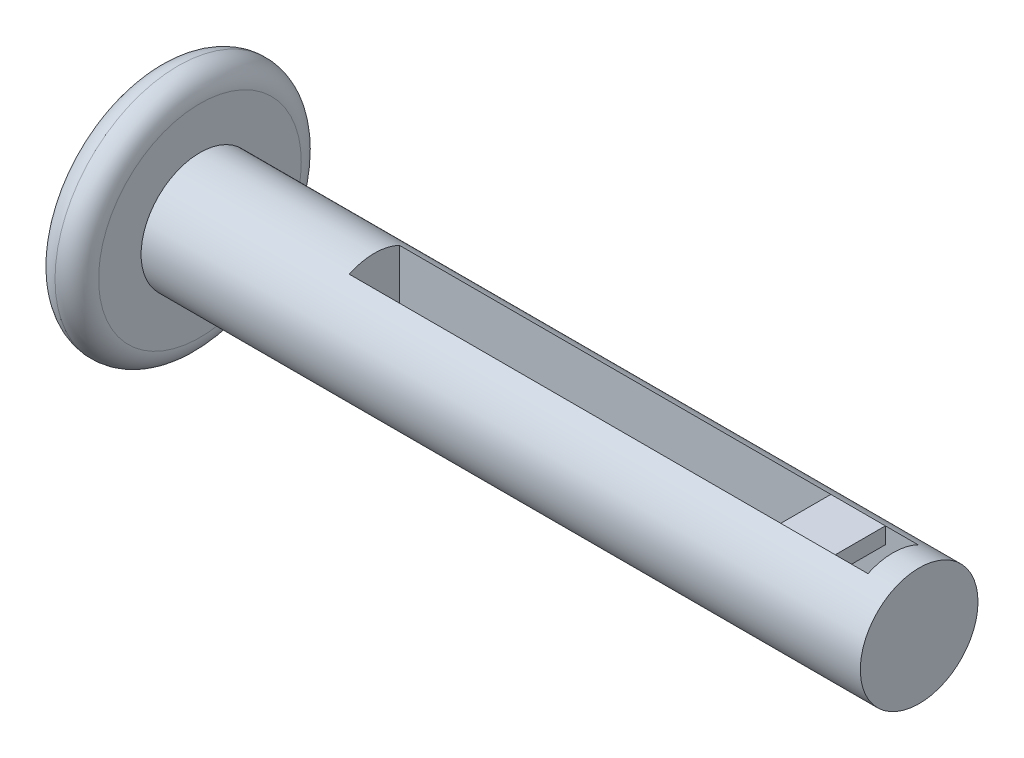
from build123d import *

# Parameters (mm, degrees)
SKETCH1_R               = 143.51
BOSS_EXTRUDE1_DEPTH     = 50.8
SKETCH2_R               = 68.58
BOSS_EXTRUDE2_DEPTH     = 838.2
CUT_EXTRUDE1_DEPTH      = 912.872381532
CUT_EXTRUDE1_DEPTH_BACK = 912.872381532
SKETCH3_W               = 604.52
SKETCH3_H               = 58.42
SKETCH4_R               = 50.8
CUT_EXTRUDE2_DEPTH      = 236.22
SKETCH5_W               = 63.5
SKETCH5_H               = 19.05
BOSS_EXTRUDE3_DEPTH     = 29.21
FILLET1_R               = 25.4
SCALE1_SCALE            = 0.05


with BuildPart() as part:
    # Sketch1 → Boss-Extrude1 (new body)
    with BuildSketch(Plane(origin=(0, 0, 0), x_dir=(0, 0, -1), z_dir=(1, 0, 0))):
        Circle(SKETCH1_R)
    extrude(amount=BOSS_EXTRUDE1_DEPTH)

    # Sketch2 → Boss-Extrude2 (add)
    with BuildSketch(Plane(origin=(50.8, 0, 0), x_dir=(0, 0, -1), z_dir=(1, 0, 0))):
        Circle(SKETCH2_R)
    extrude(amount=BOSS_EXTRUDE2_DEPTH)

    # Sketch3 → Cut-Extrude1 (cut, two sides: drawn at the far end of the back side and taken through both)
    with BuildSketch(Plane(origin=(0, 0, 0), x_dir=(1, 0, 0), z_dir=(0, 1, 0)).offset(-CUT_EXTRUDE1_DEPTH_BACK)):
        with Locations((556.26, 0)):
            Rectangle(SKETCH3_W, SKETCH3_H)
    extrude(amount=CUT_EXTRUDE1_DEPTH + CUT_EXTRUDE1_DEPTH_BACK, mode=Mode.SUBTRACT)

    # Sketch4 → Cut-Extrude2 (cut)
    with BuildSketch(Plane.ZY):
        Circle(SKETCH4_R)
    extrude(amount=-CUT_EXTRUDE2_DEPTH, mode=Mode.SUBTRACT)

    # Sketch5 → Boss-Extrude3 (add, symmetric)
    with BuildSketch(Plane.XY):
        with Locations((788.67, 52.523306182)):
            Rectangle(SKETCH5_W, SKETCH5_H)
    extrude(amount=BOSS_EXTRUDE3_DEPTH, both=True)

    # Fillet1
    fillet1_edges = [part.edges().sort_by_distance(p)[0] for p in [
        (0, 0, 143.51),
        (50.8, 0, 143.51),
    ]]
    fillet(fillet1_edges, radius=FILLET1_R - 0.0001)  # a hair under: the kernel refuses the full size


with BuildPart() as part_1:
    # Scale1: scaled about (350.332507714, 0.417323247, 0)
    add(part.part.scale(SCALE1_SCALE).moved(Location((332.815882328, 0.396457085, 0))))


solid = part_1.part
